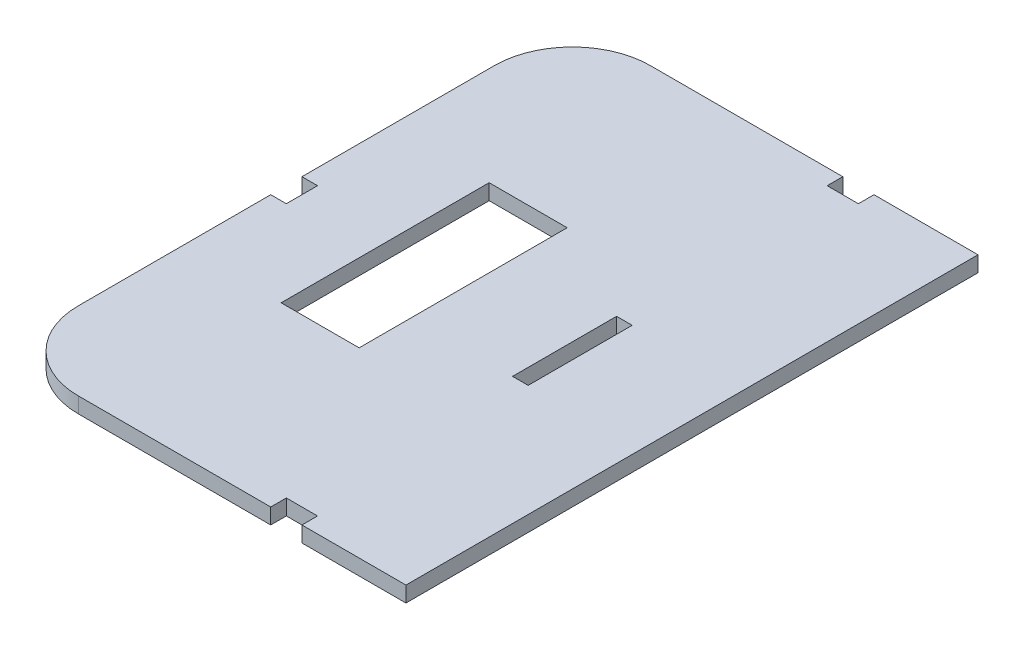
from build123d import *

# Parameters (mm, degrees)
EXTRUDE_3_DEPTH    = 3
SKETCH1_W          = 15
SKETCH1_H          = 40
SKETCH1_W_2        = 3
SKETCH1_H_2        = 20
CUT_EXTRUDE1_DEPTH = 10
FILLET1_R          = 15


with BuildPart() as part:
    # Эскиз4 → Бобышка-Вытянуть3 (new body)
    with BuildSketch(Plane(origin=(0, 0, 0), x_dir=(1, 0, 0), z_dir=(0, 1, 0))):
        Polygon((78, 0), (78, 110), (58, 110), (58, 107), (55, 107), (52, 107), (52, 110), (0, 110), (0, 58), (3, 58), (3, 55), (3, 52), (0, 52), (0, 0), (52, 0), (52, 3), (55, 3), (58, 3), (58, 0), align=None)
    extrude(amount=EXTRUDE_3_DEPTH)

    # Sketch1 → Cut-Extrude1 (cut)
    with BuildSketch(Plane(origin=(0, 3, 0), x_dir=(1, 0, 0), z_dir=(0, 1, 0))):
        with Locations((26.5, 55)):
            Rectangle(SKETCH1_W, SKETCH1_H)
        with Locations((55, 55)):
            Rectangle(SKETCH1_W_2, SKETCH1_H_2)
    extrude(amount=-CUT_EXTRUDE1_DEPTH, mode=Mode.SUBTRACT)

    # Fillet1
    fillet1_edges = [part.edges().sort_by_distance(p)[0] for p in [
        (0, 1.5, 0),
        (0, 1.5, -110),
    ]]
    fillet(fillet1_edges, radius=FILLET1_R)


solid = part.part
